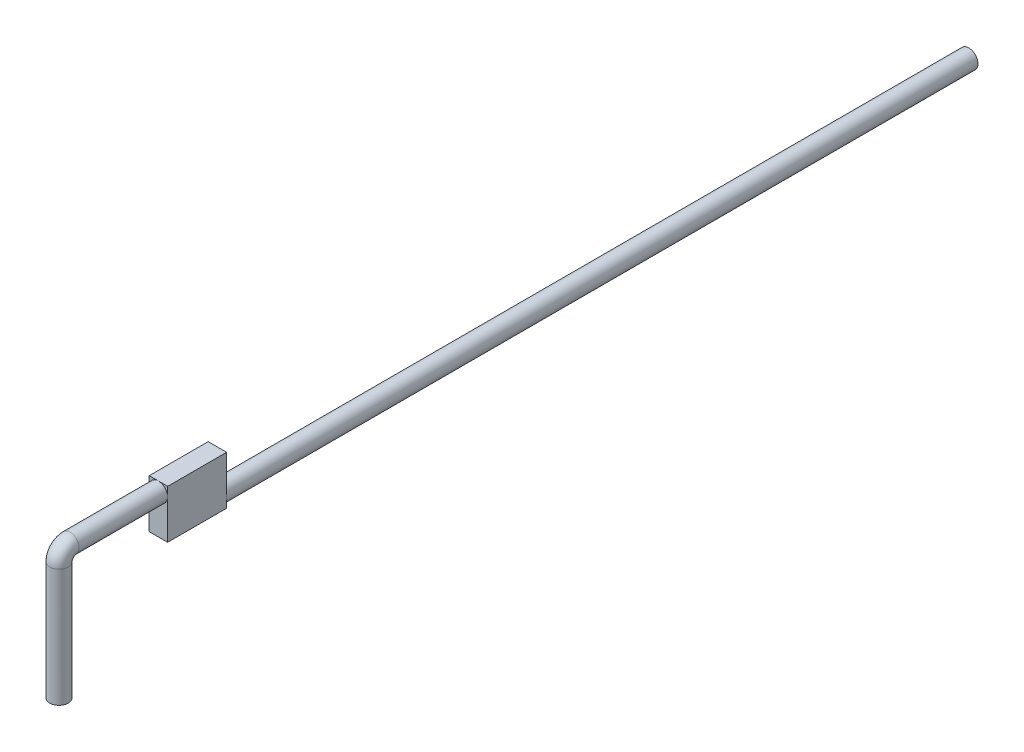
from build123d import *

# Parameters (mm, degrees)
SKETCH1_R                = 1.984375
BOSS_EXTRUDE1_DEPTH      = 168.275
BOSS_EXTRUDE2_DEPTH      = 6.35
BOSS_EXTRUDE2_DEPTH_BACK = 6.35
SKETCH2_W                = 3.96875
SKETCH2_H                = 10.455629562
SKETCH3_R                = 1.984375
BOSS_EXTRUDE3_DEPTH      = 19.05
SKETCH4_R                = 1.984375
REVOLVE5_ANGLE           = 90
SKETCH6_R                = 1.984375
BOSS_EXTRUDE4_DEPTH      = 25.4


with BuildPart() as part:
    # Sketch1 → Boss-Extrude1 (new body)
    with BuildSketch(Plane.XY):
        Circle(SKETCH1_R)
    extrude(amount=BOSS_EXTRUDE1_DEPTH)

    # Sketch2 → Boss-Extrude2 (add, two sides: drawn at the far end of the back side and taken through both)
    with BuildSketch(Plane.XY.offset(168.275).offset(-BOSS_EXTRUDE2_DEPTH_BACK)):
        with Locations((0, 3.243439781)):
            Rectangle(SKETCH2_W, SKETCH2_H)
    extrude(amount=BOSS_EXTRUDE2_DEPTH + BOSS_EXTRUDE2_DEPTH_BACK)

    # Sketch3 → Boss-Extrude3 (add)
    with BuildSketch(Plane.XY.offset(174.625)):
        with Locations((0, 6.486879562)):
            Circle(SKETCH3_R)
    extrude(amount=BOSS_EXTRUDE3_DEPTH)

    # Sketch4 → Revolve5 (revolve)
    with BuildSketch(Plane.XY.offset(193.675)):
        with Locations((0, 6.486879562)):
            Circle(SKETCH4_R)
    revolve(axis=Axis((-5.972283048, 4.112992181, 193.675), (1, 0, 0)), revolution_arc=REVOLVE5_ANGLE)

    # Sketch6 → Boss-Extrude4 (add)
    with BuildSketch(Plane.XZ.offset(-4.112992181)):
        with Locations((0, 196.048887382)):
            Circle(SKETCH6_R)
    extrude(amount=BOSS_EXTRUDE4_DEPTH)


solid = part.part
